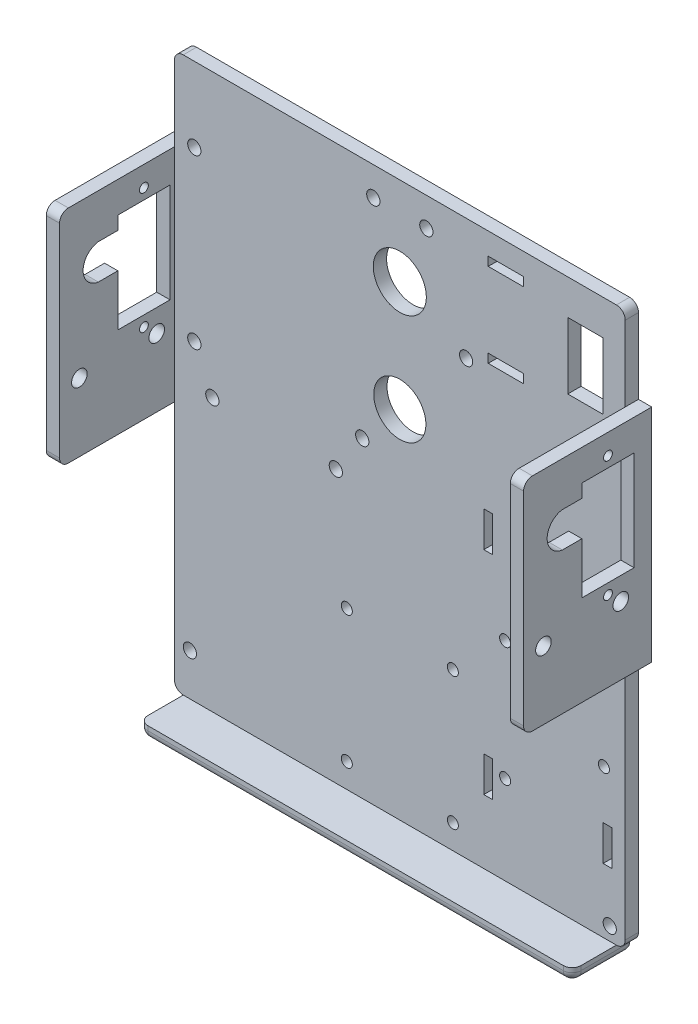
from build123d import *

# Parameters (mm, degrees)
MODEL_R                      = 6
MODEL_R_2                    = 1.5
MODEL_R_3                    = 1.25
MODEL_R_4                    = 5.9
MODEL_W                      = 8
MODEL_H                      = 2
MODEL_H_2                    = 15
MODEL_W_2                    = 2
MODEL_H_3                    = 8
SALIENTE_EXTRUIR1_DEPTH      = 3
CROQUIS3_W                   = 3
CROQUIS3_H                   = 50
SALIENTE_EXTRUIR2_DEPTH      = 29
CROQUIS4_R                   = 1.765481919
CROQUIS4_R_2                 = 1
CORTAR_EXTRUIR1_DEPTH        = 3
SALIENTE_EXTRUIR3_DEPTH      = 10
SALIENTE_EXTRUIR3_DEPTH_BACK = 3
CROQUIS5_W                   = 98
CROQUIS5_H                   = 3
REDONDEO1_R                  = 2
REDONDEO2_R                  = 2
SIMETR_A2_START              = -105
SIMETR_A2_OUTLINE_R          = 1.765481919
SIMETR_A2_OUTLINE_R_2        = 1
SIMETR_A2_DEPTH              = 3
REDONDEO3_R                  = 2


# Read off the part's stored shape, not the designer's step: Simetría2
with BuildPart() as part:
    # Model → Saliente-Extruir1 (new body)
    with BuildSketch(Plane.XY):
        with BuildLine():
            Line((-97.99999958, -2), (-4, -2))
            Line((-4, -2), (-2, -2))
            ThreePointArc((-2, -2), (-0.585786438, -1.414213562), (0, 0))
            Line((0, 0), (0, 98.451266928))
            Line((0, 98.451266928), (0, 121.451266928))
            ThreePointArc((0, 121.451266928), (-0.585786438, 122.865480491), (-2, 123.451266928))
            Line((-2, 123.451266928), (-15.5, 123.451266928))
            Line((-15.5, 123.451266928), (-86.49999958, 123.451266928))
            Line((-86.49999958, 123.451266928), (-99.99999958, 123.451266928))
            ThreePointArc((-99.99999958, 123.451266928), (-101.414213142, 122.865480491), (-101.99999958, 121.451266928))
            Line((-101.99999958, 121.451266928), (-101.99999958, 98.451266928))
            Line((-101.99999958, 98.451266928), (-101.99999958, 0))
            ThreePointArc((-101.99999958, 0), (-101.414213142, -1.414213562), (-99.99999958, -2))
            Line((-99.99999958, -2), (-97.99999958, -2))
        make_face()
        with Locations((-50.99999979, 103.487076976)):
            Circle(MODEL_R, mode=Mode.SUBTRACT)
        with Locations((-97.5, 106.57)):
            Circle(MODEL_R_2, mode=Mode.SUBTRACT)
        with Locations((-65.47999979, 59.57)):
            Circle(MODEL_R_2, mode=Mode.SUBTRACT)
        with Locations((-93.41999979, 59.57)):
            Circle(MODEL_R_2, mode=Mode.SUBTRACT)
        with Locations((-62.99999979, 3.5)):
            Circle(MODEL_R_3, mode=Mode.SUBTRACT)
        with Locations((-98.49999979, 7.5)):
            Circle(MODEL_R_2, mode=Mode.SUBTRACT)
        with Locations((-38.99999979, 3.5)):
            Circle(MODEL_R_3, mode=Mode.SUBTRACT)
        with Locations((-38.99999979, 33.5)):
            Circle(MODEL_R_3, mode=Mode.SUBTRACT)
        with Locations((-62.99999979, 33.5)):
            Circle(MODEL_R_3, mode=Mode.SUBTRACT)
        with Locations((-59.5, 68.57)):
            Circle(MODEL_R_2, mode=Mode.SUBTRACT)
        with Locations((-97.5, 68.57)):
            Circle(MODEL_R_2, mode=Mode.SUBTRACT)
        with Locations((-4.825, 31.570044653)):
            Circle(MODEL_R_3, mode=Mode.SUBTRACT)
        with Locations((-27.175, 45.070044653)):
            Circle(MODEL_R_3, mode=Mode.SUBTRACT)
        with Locations((-27.175, 18.070044653)):
            Circle(MODEL_R_3, mode=Mode.SUBTRACT)
        with Locations((-45, 116.951266928)):
            Circle(MODEL_R_2, mode=Mode.SUBTRACT)
        with Locations((-3.5, 1)):
            Circle(MODEL_R_2, mode=Mode.SUBTRACT)
        with Locations((-36, 96)):
            Circle(MODEL_R_2, mode=Mode.SUBTRACT)
        with Locations((-50.99999979, 78.487076976)):
            Circle(MODEL_R_4, mode=Mode.SUBTRACT)
        with Locations((-57, 116.951266928)):
            Circle(MODEL_R_2, mode=Mode.SUBTRACT)
        with Locations((-27, 117.5)):
            Rectangle(MODEL_W, MODEL_H, mode=Mode.SUBTRACT)
        with Locations((-27, 98.5)):
            Rectangle(MODEL_W, MODEL_H, mode=Mode.SUBTRACT)
        with Locations((-8.99997272, 108)):
            Rectangle(MODEL_W, MODEL_H_2, mode=Mode.SUBTRACT)
        with Locations((-31, 16.5)):
            Rectangle(MODEL_W_2, MODEL_H_3, mode=Mode.SUBTRACT)
        with Locations((-4, 16.5)):
            Rectangle(MODEL_W_2, MODEL_H_3, mode=Mode.SUBTRACT)
        with Locations((-31, 64.5)):
            Rectangle(MODEL_W_2, MODEL_H_3, mode=Mode.SUBTRACT)
        with Locations((-4, 64.5)):
            Rectangle(MODEL_W_2, MODEL_H_3, mode=Mode.SUBTRACT)
    extrude(amount=-SALIENTE_EXTRUIR1_DEPTH)

    # Croquis3 → Saliente-Extruir2 (add)
    with BuildSketch(Plane(origin=(0, 0, -3), x_dir=(-1, 0, 0), z_dir=(0, 0, -1))):
        with Locations((-1.5, 79.451266928)):
            Rectangle(CROQUIS3_W, CROQUIS3_H)
    extrude(amount=-SALIENTE_EXTRUIR2_DEPTH)

    # Croquis4 → Cortar-Extruir1 (cut)
    with BuildSketch(Plane(origin=(3, 0, 0), x_dir=(0, 0, -1), z_dir=(1, 0, 0))):
        with Locations(Location((-21.50299208, 69.851266928, 0), (0, 0, 90))):
            Circle(CROQUIS4_R)
        with Locations(Location((-4.00299208, 69.851266928, 0), (0, 0, 90))):
            Circle(CROQUIS4_R)
        with Locations(Location((-6.90299208, 72.551442507, 0), (0, 0, 90))):
            Circle(CROQUIS4_R_2)
        with Locations(Location((-6.90299208, 99.851266928, 0), (0, 0, 90))):
            Circle(CROQUIS4_R_2)
        with BuildLine():
            Line((-1.00299208, 74.951266928), (-1.00299208, 97.451266928))
            Line((-1.00299208, 97.451266928), (-12.80299208, 97.451266928))
            Line((-12.80299208, 97.451266928), (-12.80299208, 94.451266928))
            Line((-12.80299208, 94.451266928), (-17.30299208, 94.451266928))
            ThreePointArc((-17.30299208, 94.451266928), (-20.663851557, 90.457675656), (-17.21410405, 86.540611727))
            Line((-17.21410405, 86.540611727), (-12.80299208, 86.540611727))
            Line((-12.80299208, 86.540611727), (-12.80299208, 74.951266928))
            Line((-12.80299208, 74.951266928), (-1.00299208, 74.951266928))
        make_face()
    extrude(amount=-CORTAR_EXTRUIR1_DEPTH, mode=Mode.SUBTRACT)

    # Redondeo1
    redondeo1_edges = [part.edges().sort_by_distance(p)[0] for p in [
        (1.5, 54.451266928, 26),
        (1.5, 104.451266928, 26),
    ]]
    fillet(redondeo1_edges, radius=REDONDEO1_R)


with BuildPart() as body_2:
    # Croquis5 → Saliente-Extruir3 (new, two sides: drawn at the far end of the back side and taken through both)
    with BuildSketch(Plane.XY.offset(-SALIENTE_EXTRUIR3_DEPTH_BACK)):
        with Locations((-51, -3.5)):
            Rectangle(CROQUIS5_W, CROQUIS5_H)
    extrude(amount=SALIENTE_EXTRUIR3_DEPTH + SALIENTE_EXTRUIR3_DEPTH_BACK)

    # Redondeo2
    redondeo2_edges = [body_2.edges().sort_by_distance(p)[0] for p in [
        (-100, -3.5, 10),
        (-2, -3.5, 10),
    ]]
    fillet(redondeo2_edges, radius=REDONDEO2_R)

    # Redondeo3
    redondeo3_edges = [body_2.edges().sort_by_distance(p)[0] for p in [
        (-51, -5, -3),
        (-51, -5, 10),
        (-2.585786438, -5, 9.414213562),
        (-99.414213562, -5, 9.414213562),
        (-2, -5, 2.5),
        (-100, -5, 2.5),
    ]]
    fillet(redondeo3_edges, radius=REDONDEO3_R)


with BuildPart() as simetr_a2_tool:
    # Simetría2 outline → Simetría2 (new body)
    with BuildSketch(Plane.YZ.offset(SIMETR_A2_START)):
        with BuildLine():
            Line((54.451266928, 24), (54.451266928, -3))
            Line((54.451266928, -3), (104.451266928, -3))
            Line((104.451266928, -3), (104.451266928, 24))
            ThreePointArc((104.451266928, 24), (103.865480491, 25.414213563), (102.451266928, 26))
            Line((102.451266928, 26), (56.451266928, 26))
            ThreePointArc((56.451266928, 26), (55.037053366, 25.414213562), (54.451266928, 24))
        make_face()
        with Locations((69.851266928, 4.00299208)):
            Circle(SIMETR_A2_OUTLINE_R, mode=Mode.SUBTRACT)
        with Locations((72.551442507, 6.90299208)):
            Circle(SIMETR_A2_OUTLINE_R_2, mode=Mode.SUBTRACT)
        with BuildLine():
            Line((86.540611727, 12.80299208), (86.540611727, 17.21410405))
            ThreePointArc((86.540611727, 17.21410405), (90.457675655, 20.663851557), (94.451266928, 17.30299208))
            Line((94.451266928, 17.30299208), (94.451266928, 12.80299208))
            Line((94.451266928, 12.80299208), (97.451266928, 12.80299208))
            Line((97.451266928, 12.80299208), (97.451266928, 1.00299208))
            Line((97.451266928, 1.00299208), (74.951266928, 1.00299208))
            Line((74.951266928, 1.00299208), (74.951266928, 12.80299208))
            Line((74.951266928, 12.80299208), (86.540611727, 12.80299208))
        make_face(mode=Mode.SUBTRACT)
        with Locations((99.851266928, 6.90299208)):
            Circle(SIMETR_A2_OUTLINE_R_2, mode=Mode.SUBTRACT)
        with Locations((69.851266928, 21.50299208)):
            Circle(SIMETR_A2_OUTLINE_R, mode=Mode.SUBTRACT)
    extrude(amount=SIMETR_A2_DEPTH)


with BuildPart() as part_1:
    add(part.part)


with BuildPart() as part_2:
    # Simetría2: joined with simetr_a2_tool
    add(part_1.part.fuse(simetr_a2_tool.part, tol=0.00001))


solid = Compound([body_2.part, part_2.part])
